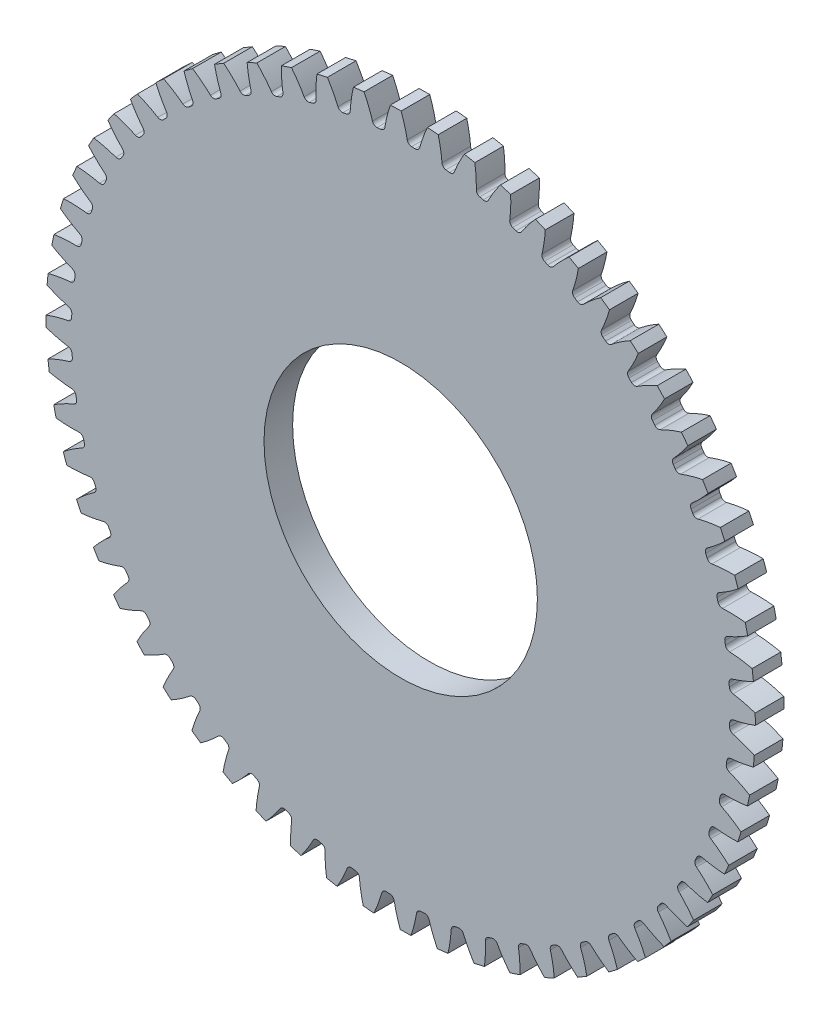
from build123d import *

# Parameters (mm, degrees)
SKETCH3_R         = 78.74
GEARBODY_DEPTH    = 6.35
TOOTHCUT_DEPTH    = 112.536082502
CIRPATTERN1_COUNT = 60
BOREDIA_R         = 30.353001332
BORE_DEPTH        = 12700


with BuildPart() as part:
    # Sketch3 → gearBody (new body)
    with BuildSketch(Plane.XY):
        Circle(SKETCH3_R)
    extrude(amount=GEARBODY_DEPTH)

    # Sketch2 → toothCut (cut, through all)
    with BuildSketch(Plane.XY):
        with BuildLine():
            ThreePointArc((73.03100387, -3.20279802), (73.047280236, -2.807185711), (73.061413567, -2.411491046))
            ThreePointArc((73.061413567, -2.411491046), (73.30149223, -1.7922886), (73.875449596, -1.458189248))
            ThreePointArc((73.875449596, -1.458189248), (84.75836029, 2.96137177), (93.135799821, 11.194765462))
            ThreePointArc((93.135799821, 11.194765462), (93.73699122, -3.60228528), (92.001957355, -18.309555566))
            ThreePointArc((92.001957355, -18.309555566), (84.281106308, -9.457509255), (73.769476867, -4.215762288))
            ThreePointArc((73.769476867, -4.215762288), (73.222853105, -3.83859933), (73.03100387, -3.20279802))
        make_face()
    toothcut = extrude(amount=TOOTHCUT_DEPTH, mode=Mode.SUBTRACT)

    # CirPattern1: toothCut ×60 about axis
    cirpattern1_axis = Axis((0, 0, 6.35), (0, 0, -1))
    for i in range(1, CIRPATTERN1_COUNT):
        add(toothcut.rotate(cirpattern1_axis, i * 360 / CIRPATTERN1_COUNT), mode=Mode.SUBTRACT)

    # boreDia → bore (cut, symmetric)
    with BuildSketch(Plane.XY):
        Circle(BOREDIA_R)
    extrude(amount=BORE_DEPTH, both=True, mode=Mode.SUBTRACT)


solid = part.part
